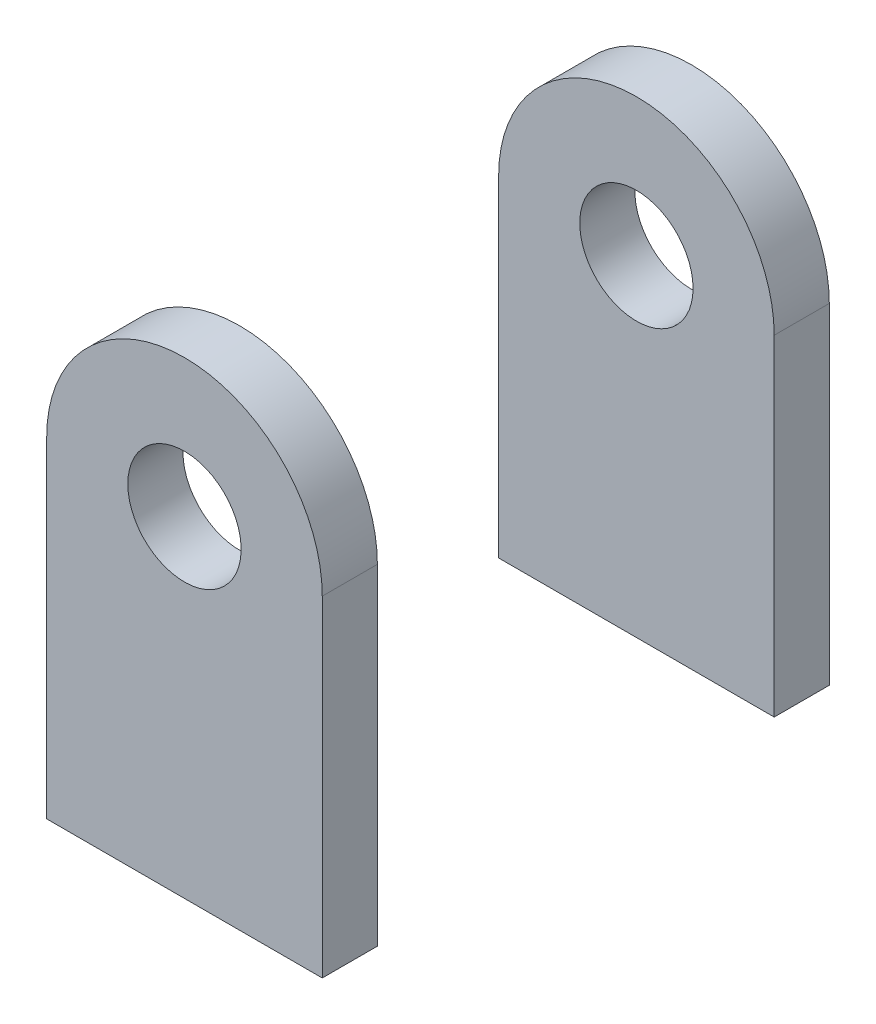
from build123d import *

# Parameters (mm, degrees)
BOSS_EXTRUDE1_START = 11.43
SKETCH1_R           = 3.2639
BOSS_EXTRUDE1_DEPTH = 3.175
BOSS_EXTRUDE2_START = -11.43
SKETCH1_4_R         = 3.2639
BOSS_EXTRUDE2_DEPTH = 3.175


with BuildPart() as part:
    # Sketch1 → Boss-Extrude1 (new body)
    with BuildSketch(Plane.XY.offset(BOSS_EXTRUDE1_START)):
        with BuildLine():
            ThreePointArc((7.9375, 0), (0, 7.9375), (-7.9375, 0))
            Line((-7.9375, 0), (-7.9375, -19.05))
            Line((-7.9375, -19.05), (7.9375, -19.05))
            Line((7.9375, -19.05), (7.9375, 0))
        make_face()
        Circle(SKETCH1_R, mode=Mode.SUBTRACT)
    extrude(amount=BOSS_EXTRUDE1_DEPTH)


with BuildPart() as body_2:
    # Sketch1<4> → Boss-Extrude2 (new body)
    with BuildSketch(Plane.XY.offset(BOSS_EXTRUDE2_START)):
        with BuildLine():
            ThreePointArc((7.9375, 0), (0, 7.9375), (-7.9375, 0))
            Line((-7.9375, 0), (-7.9375, -19.05))
            Line((-7.9375, -19.05), (7.9375, -19.05))
            Line((7.9375, -19.05), (7.9375, 0))
        make_face()
        Circle(SKETCH1_4_R, mode=Mode.SUBTRACT)
    extrude(amount=-BOSS_EXTRUDE2_DEPTH)


solid = Compound([part.part, body_2.part])
